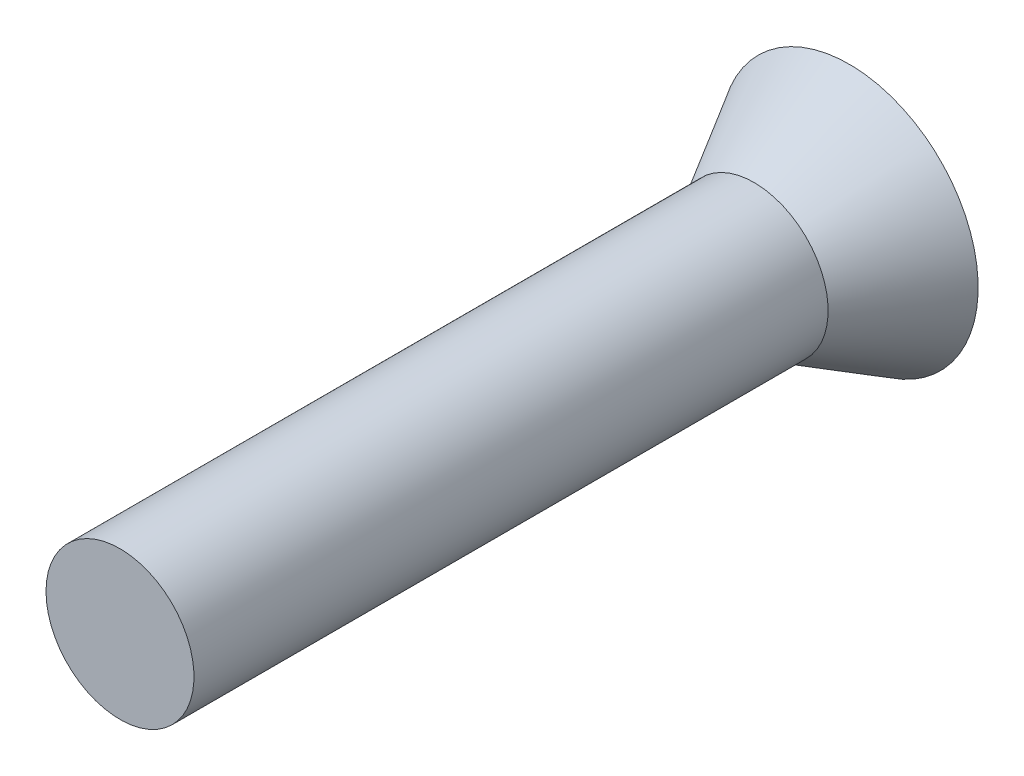
from build123d import *

# Parameters (mm, degrees)
CUT_EXTRUDE1_DEPTH = 0.25
CHAMFER1_SIZE      = 0.1
CHAMFER2_SIZE      = 0.1
CHAMFER3_SIZE      = 0.25


with BuildPart() as part:
    # Sketch2 → Revolve1 (revolve)
    with BuildSketch(Plane(origin=(0, 0, 0), x_dir=(1, 0, 0), z_dir=(0, 1, 0))):
        Polygon((0, 0), (0, 5.9), (-1.219615242, 5.9), (-0.7, 5), (-0.7, -1), (0, -1), align=None)
    revolve(axis=Axis((0, 0, -52.449576884), (0, 0, 1)))

    # Sketch4 → Cut-Extrude1 (cut)
    with BuildSketch(Plane(origin=(0, 0, -5.9), x_dir=(-1, 0, 0), z_dir=(0, 0, -1))):
        Polygon((0, 0.75), (-0.196763203, 0.75), (-0.196763203, 0.196763203), (-0.75, 0.196763203), (-0.75, -0.196763203), (-0.196763203, -0.196763203), (-0.196763203, -0.75), (0.196763203, -0.75), (0.196763203, -0.196763203), (0.75, -0.196763203), (0.75, 0.196763203), (0.196763203, 0.196763203), (0.196763203, 0.75), align=None)
    extrude(amount=-CUT_EXTRUDE1_DEPTH, mode=Mode.SUBTRACT)

    # Chamfer1
    chamfer1_edges = [part.edges().sort_by_distance(p)[0] for p in [
        (-0.196763203, 0.196763203, -5.775),
        (-0.196763203, -0.196763203, -5.775),
        (0.196763203, -0.196763203, -5.775),
        (0.196763203, 0.196763203, -5.775),
    ]]
    chamfer(chamfer1_edges, length=CHAMFER1_SIZE)

    # Chamfer2
    chamfer2_edges = [part.edges().sort_by_distance(p)[0] for p in [
        (-0.196763203, 0.75, -5.775),
        (-0.75, 0.196763203, -5.775),
        (-0.75, -0.196763203, -5.775),
        (-0.196763203, -0.75, -5.775),
        (0.196763203, -0.75, -5.775),
        (0.75, -0.196763203, -5.775),
        (0.75, 0.196763203, -5.775),
        (0.196763203, 0.75, -5.775),
    ]]
    chamfer(chamfer2_edges, length=CHAMFER2_SIZE)

    # Chamfer3
    chamfer3_edges = [part.edges().sort_by_distance(p)[0] for p in [
        (0, -0.75, -5.65),
        (0.75, 0, -5.65),
        (-0.75, 0, -5.65),
        (0, 0.75, -5.65),
    ]]
    chamfer(chamfer3_edges, length=CHAMFER3_SIZE - 0.0001)  # a hair under: the kernel refuses the full size


solid = part.part
